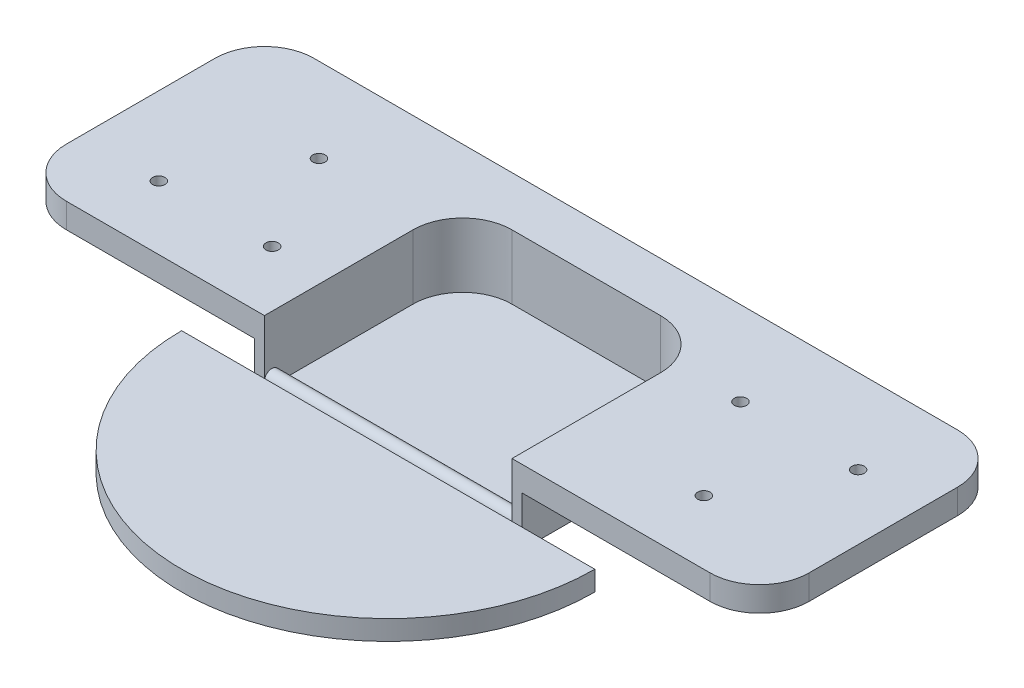
from build123d import *

# Parameters (mm, degrees)
BOSS_EXTRUDE1_DEPTH      = 75
CUT_EXTRUDE1_DEPTH       = 65
SHELL1_START             = -75
SHELL1_DEPTH             = 65
CUT_EXTRUDE3_DEPTH       = 50
SKETCH6_R                = 6.25
CUT_EXTRUDE4_DEPTH       = 10
BOSS_EXTRUDE2_DEPTH      = 10
BOSS_EXTRUDE2_DEPTH_BACK = 10
BOSS_EXTRUDE5_REACH      = 607.748
SKETCH10_R               = 7.5


# Read off the part's stored shape, not the designer's step: Shell1
with BuildPart() as part:
    # Sketch1 → Boss-Extrude1 (new body)
    with BuildSketch(Plane(origin=(0, 0, 0), x_dir=(1, 0, 0), z_dir=(0, 1, 0))):
        with BuildLine():
            Line((325, -125), (-325, -125))
            ThreePointArc((-325, -125), (-360.355339059, -110.355339059), (-375, -75))
            Line((-375, -75), (-375, 75))
            ThreePointArc((-375, 75), (-360.355339059, 110.355339059), (-325, 125))
            Line((-325, 125), (325, 125))
            ThreePointArc((325, 125), (360.355339059, 110.355339059), (375, 75))
            Line((375, 75), (375, -75))
            ThreePointArc((375, -75), (360.355339059, -110.355339059), (325, -125))
        make_face()
    extrude(amount=-BOSS_EXTRUDE1_DEPTH)

    # Sketch2 → Cut-Extrude1 (cut)
    with BuildSketch(Plane(origin=(0, 0, 0), x_dir=(1, 0, 0), z_dir=(0, 1, 0))):
        with BuildLine():
            Line((125, -125), (-125, -125))
            Line((-125, -125), (-125, 25))
            ThreePointArc((-125, 25), (-110.355339059, 60.355339059), (-75, 75))
            Line((-75, 75), (75, 75))
            ThreePointArc((75, 75), (110.355339059, 60.355339059), (125, 25))
            Line((125, 25), (125, -125))
        make_face()
    extrude(amount=-CUT_EXTRUDE1_DEPTH, mode=Mode.SUBTRACT)

    # Shell1 outline → Shell1 (cut)
    with BuildSketch(Plane(origin=(0, 0, 0), x_dir=(1, 0, 0), z_dir=(0, 1, 0)).offset(SHELL1_START)):
        with BuildLine():
            ThreePointArc((-365, -75), (-353.284271247, -103.284271247), (-325, -115))
            Line((-325, -115), (-135, -115))
            Line((-135, -115), (-135, 25))
            ThreePointArc((-135, 25), (-117.426406871, 67.426406871), (-75, 85))
            Line((-75, 85), (75, 85))
            ThreePointArc((75, 85), (117.426406871, 67.426406871), (135, 25))
            Line((135, 25), (135, -115))
            Line((135, -115), (325, -115))
            ThreePointArc((325, -115), (353.284271247, -103.284271247), (365, -75))
            Line((365, -75), (365, 75))
            ThreePointArc((365, 75), (353.284271247, 103.284271247), (325, 115))
            Line((325, 115), (-325, 115))
            ThreePointArc((-325, 115), (-353.284271247, 103.284271247), (-365, 75))
            Line((-365, 75), (-365, -75))
        make_face()
    extrude(amount=SHELL1_DEPTH, mode=Mode.SUBTRACT)

    # Sketch5 → Cut-Extrude3 (cut)
    with BuildSketch(Plane.XZ.offset(75)):
        with BuildLine():
            ThreePointArc((375, 75), (360.355339059, 110.355339059), (325, 125))
            Line((325, 125), (135, 125))
            Line((135, 125), (135, 115))
            Line((135, 115), (325, 115))
            ThreePointArc((325, 115), (353.284271247, 103.284271247), (365, 75))
            Line((365, 75), (365, -75))
            ThreePointArc((365, -75), (353.284271247, -103.284271247), (325, -115))
            Line((325, -115), (-325, -115))
            ThreePointArc((-325, -115), (-353.284271247, -103.284271247), (-365, -75))
            Line((-365, -75), (-365, 75))
            ThreePointArc((-365, 75), (-353.284271247, 103.284271247), (-325, 115))
            Line((-325, 115), (-135, 115))
            Line((-135, 115), (-135, 125))
            Line((-135, 125), (-325, 125))
            ThreePointArc((-325, 125), (-360.355339059, 110.355339059), (-375, 75))
            Line((-375, 75), (-375, -75))
            ThreePointArc((-375, -75), (-360.355339059, -110.355339059), (-325, -125))
            Line((-325, -125), (325, -125))
            ThreePointArc((325, -125), (360.355339059, -110.355339059), (375, -75))
            Line((375, -75), (375, 75))
        make_face()
    extrude(amount=-CUT_EXTRUDE3_DEPTH, mode=Mode.SUBTRACT)

    # Sketch6 → Cut-Extrude4 (cut)
    with BuildSketch(Plane(origin=(0, 0, 0), x_dir=(1, 0, 0), z_dir=(0, 1, 0))):
        with Locations(Location((-181.615600277, -60.604768145, 0), (0, 0, 270))):
            Circle(SKETCH6_R)
        with Locations(Location((-296.0691952, -60.604768145, 0), (0, 0, 270))):
            Circle(SKETCH6_R)
        with Locations(Location((-234.868314581, 39.939535728, 0), (0, 0, 270))):
            Circle(SKETCH6_R)
        with Locations(Location((190.755991538, 39.939535728, 0), (0, 0, 270))):
            Circle(SKETCH6_R)
        with Locations(Location((309.581077934, 39.939535728, 0), (0, 0, 270))):
            Circle(SKETCH6_R)
        with Locations(Location((254.341322051, -60.604768145, 0), (0, 0, 270))):
            Circle(SKETCH6_R)
    extrude(amount=-CUT_EXTRUDE4_DEPTH, mode=Mode.SUBTRACT)

    # Sketch7 → Boss-Extrude2 (add, two sides: drawn at the far end of the back side and taken through both)
    with BuildSketch(Plane(origin=(0, -65, 0), x_dir=(1, 0, 0), z_dir=(0, 1, 0)).offset(-BOSS_EXTRUDE2_DEPTH_BACK)):
        with BuildLine():
            Line((-208.624281034, -125), (208.624281034, -125))
            ThreePointArc((208.624281034, -125), (0, -333.624281034), (-208.624281034, -125))
        make_face()
    extrude(amount=BOSS_EXTRUDE2_DEPTH + BOSS_EXTRUDE2_DEPTH_BACK)


with BuildPart() as body_2:

    # Sketch10 → Boss-Extrude5 (new, up to next)
    with BuildSketch(Plane(origin=(-125, 0, 0), x_dir=(0, 0, -1), z_dir=(1, 0, 0)), mode=Mode.PRIVATE) as boss_extrude5_sk1:
        with Locations((-117.5, -57.5)):
            Circle(SKETCH10_R)
    boss_extrude5_tool1 = extrude(boss_extrude5_sk1.sketch, amount=BOSS_EXTRUDE5_REACH, mode=Mode.PRIVATE) - part.part
    add(boss_extrude5_tool1.solids().sort_by_distance((-125, -57.5, 117.5))[0])


solid = Compound([part.part, body_2.part])
